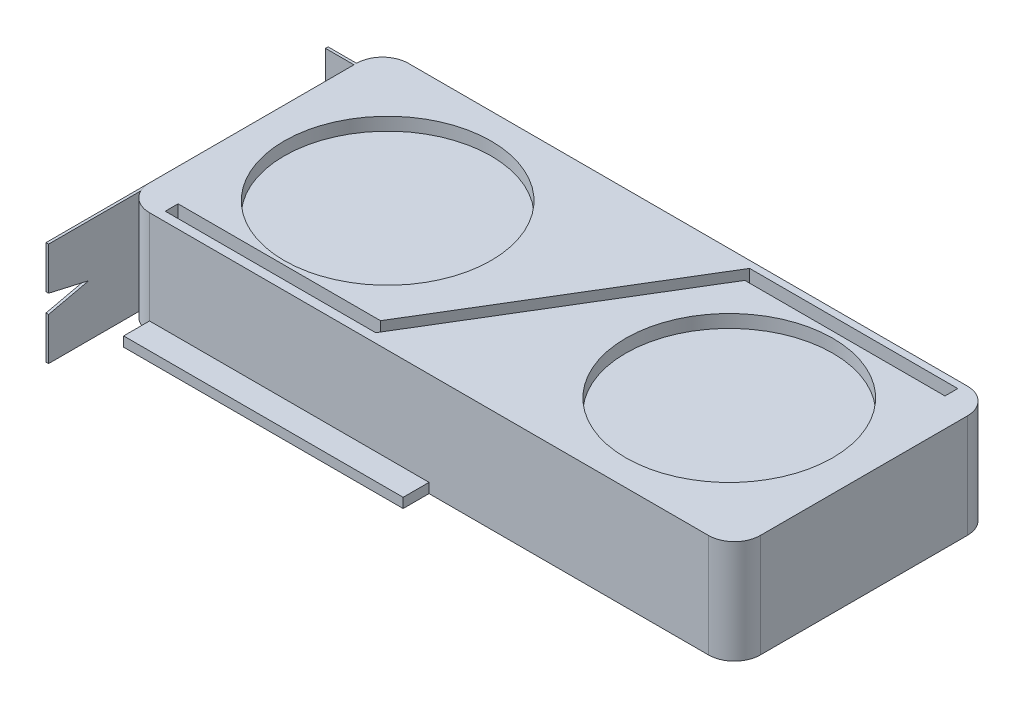
from build123d import *

# Parameters (mm, degrees)
SKETCH1_W           = 236
SKETCH1_H           = 100
BOSS_EXTRUDE1_DEPTH = 40
SKETCH2_R           = 40
CUT_EXTRUDE1_DEPTH  = 5
FILLET1_R           = 10
CUT_EXTRUDE2_DEPTH  = 10
SKETCH4_W           = 108
SKETCH4_H           = 3.774903877
BOSS_EXTRUDE2_DEPTH = 10
BOSS_EXTRUDE3_DEPTH = 1
SKETCH6_W           = 1
SKETCH6_H           = 40
BOSS_EXTRUDE4_DEPTH = 11


with BuildPart() as part:
    # Sketch1 → Boss-Extrude1 (new body)
    with BuildSketch(Plane(origin=(0, 0, 0), x_dir=(1, 0, 0), z_dir=(0, 1, 0))):
        Rectangle(SKETCH1_W, SKETCH1_H)
    extrude(amount=BOSS_EXTRUDE1_DEPTH)

    # Sketch2 → Cut-Extrude1 (cut)
    with BuildSketch(Plane(origin=(0, 40, 0), x_dir=(1, 0, 0), z_dir=(0, 1, 0))):
        with Locations((-66, 0)):
            Circle(SKETCH2_R)
        with Locations((66, 0)):
            Circle(SKETCH2_R)
    extrude(amount=-CUT_EXTRUDE1_DEPTH, mode=Mode.SUBTRACT)

    # Fillet1
    fillet1_edges = [part.edges().sort_by_distance(p)[0] for p in [
        (118, 20, 50),
        (118, 20, -50),
        (-118, 20, 50),
        (-118, 20, -50),
    ]]
    fillet(fillet1_edges, radius=FILLET1_R)

    # Sketch3 → Cut-Extrude2 (cut)
    with BuildSketch(Plane(origin=(0, 40, 0), x_dir=(1, 0, 0), z_dir=(0, 1, 0))):
        Polygon((-105.463124796, -41.502087977), (-105.463124796, -46.455012056), (-24.138936023, -46.455012056), (29.66006691, 42.356040404), (107.000239166, 42.356040404), (107.000239166, 47.308964484), (26.557920495, 47.308964484), (-27.241082437, -41.502087977), align=None)
    extrude(amount=-CUT_EXTRUDE2_DEPTH, mode=Mode.SUBTRACT)

    # Sketch4 → Boss-Extrude2 (add)
    with BuildSketch(Plane.XY.offset(50)):
        with Locations((-54, 1.887451939)):
            Rectangle(SKETCH4_W, SKETCH4_H)
    extrude(amount=BOSS_EXTRUDE2_DEPTH)

    # Sketch6 → Boss-Extrude4 (add)
    with BuildSketch(Plane.ZY.offset(118)):
        with Locations((-39.5, 20)):
            Rectangle(SKETCH6_W, SKETCH6_H)
    extrude(amount=BOSS_EXTRUDE4_DEPTH)


with BuildPart() as body_2:
    # Sketch5 → Boss-Extrude3 (new body)
    with BuildSketch(Plane.ZY.offset(118)):
        Polygon((40, 40), (80, 40), (80, 23.543767562), (64.464749099, 20), (80, 16.456232438), (80, 0), (40, 0), align=None)
    extrude(amount=-BOSS_EXTRUDE3_DEPTH)


solid = Compound([part.part, body_2.part])
